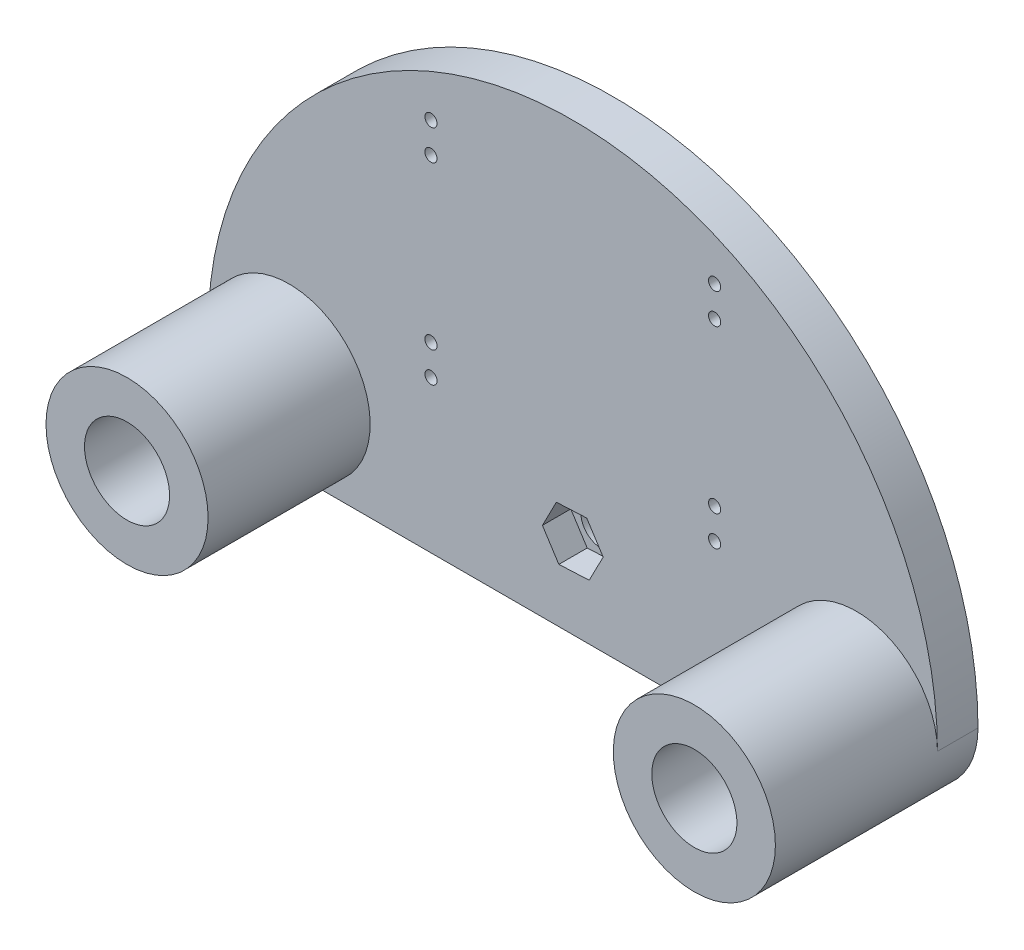
from build123d import *

# Parameters (mm, degrees)
BOSS_EXTRUDE8_OUTLINE_R   = 10.5
BOSS_EXTRUDE8_OUTLINE_R_2 = 1.5
BOSS_EXTRUDE8_DEPTH       = 10
SKETCH5_R                 = 10
SKETCH5_R_2               = 5
BOSS_EXTRUDE10_DEPTH      = 3
SKETCH7_R                 = 20
SKETCH7_R_2               = 10.5
BOSS_EXTRUDE11_DEPTH      = 50
SKETCH8_R                 = 20
SKETCH8_R_2               = 7
BOSS_EXTRUDE13_DEPTH      = 3


with BuildPart() as part:
    # Boss-Extrude8: read off the stored shape, not the designer's step
    # Boss-Extrude8 outline → Boss-Extrude8 (new body)
    with BuildSketch(Plane.XY):
        with BuildLine():
            ThreePointArc((176.037015378, 1.723482717), (86.037015378, 91.723482717), (-3.962984622, 1.723482717))
            ThreePointArc((-3.962984622, 1.723482717), (1.894879754, -12.418652907), (16.037015378, -18.276517283))
            Line((16.037015378, -18.276517283), (156.037046796, -18.241067052))
            ThreePointArc((156.037046796, -18.241067052), (170.166643311, -12.395730676), (176.037015378, 1.723482717))
        make_face()
        with Locations((16.037015378, 1.723482717)):
            Circle(BOSS_EXTRUDE8_OUTLINE_R, mode=Mode.SUBTRACT)
        Polygon((81.979520172, 8.037757496), (89.47659014, 8.394514031), (93.534085346, 2.080239251), (90.094510583, -4.590792062), (82.597440615, -4.947548597), (78.539945409, 1.366726183), align=None, mode=Mode.SUBTRACT)
        with Locations((51.037015378, 19.223482717)):
            Circle(BOSS_EXTRUDE8_OUTLINE_R_2, mode=Mode.SUBTRACT)
        with Locations((51.037015378, 26.723482717)):
            Circle(BOSS_EXTRUDE8_OUTLINE_R_2, mode=Mode.SUBTRACT)
        with Locations((156.037046796, 1.758932948)):
            Circle(BOSS_EXTRUDE8_OUTLINE_R, mode=Mode.SUBTRACT)
        with Locations((121.037015378, 19.223482717)):
            Circle(BOSS_EXTRUDE8_OUTLINE_R_2, mode=Mode.SUBTRACT)
        with Locations((121.037015378, 26.723482717)):
            Circle(BOSS_EXTRUDE8_OUTLINE_R_2, mode=Mode.SUBTRACT)
        with Locations((51.037015378, 66.723482717)):
            Circle(BOSS_EXTRUDE8_OUTLINE_R_2, mode=Mode.SUBTRACT)
        with Locations((51.037015378, 74.223482717)):
            Circle(BOSS_EXTRUDE8_OUTLINE_R_2, mode=Mode.SUBTRACT)
        with Locations((121.037015378, 66.723482717)):
            Circle(BOSS_EXTRUDE8_OUTLINE_R_2, mode=Mode.SUBTRACT)
        with Locations((121.037015378, 74.223482717)):
            Circle(BOSS_EXTRUDE8_OUTLINE_R_2, mode=Mode.SUBTRACT)
    extrude(amount=BOSS_EXTRUDE8_DEPTH)

    # Sketch5 → Boss-Extrude10 (add)
    with BuildSketch(Plane.XY):
        with Locations((86.037015378, 1.723482717)):
            Circle(SKETCH5_R)
        with Locations((86.037015378, 1.723482717)):
            Circle(SKETCH5_R_2, mode=Mode.SUBTRACT)
    extrude(amount=BOSS_EXTRUDE10_DEPTH)


with BuildPart() as boss_extrude11_tool:
    # Sketch7 → Boss-Extrude11 (new body)
    # profile 1 of 2: a face of its own
    with BuildSketch(Plane.XY):
        with Locations(Location((156.037046796, 1.758932948, 0), (0, 0, 270))):
            Circle(SKETCH7_R)
        with Locations(Location((156.037046796, 1.758932948, 0), (0, 0, 180))):
            Circle(SKETCH7_R_2, mode=Mode.SUBTRACT)
    # profile 2 of 2: a face of its own
    with BuildSketch(Plane.XY):
        with Locations(Location((16.037015378, 1.723482717, 0), (0, 0, 180))):
            Circle(SKETCH7_R)
        with Locations(Location((16.037015378, 1.723482717, 0), (0, 0, 180))):
            Circle(SKETCH7_R_2, mode=Mode.SUBTRACT)
    extrude(amount=BOSS_EXTRUDE11_DEPTH)


with BuildPart() as part_1:
    add(part.part)


with BuildPart() as part_2:
    # Boss-Extrude11: joined with boss_extrude11_tool
    add(part_1.part.fuse(boss_extrude11_tool.part, tol=0.00001))

    # Sketch8 → Boss-Extrude13 (add)
    # profile 1 of 2: a face of its own
    with BuildSketch(Plane.XY):
        with Locations(Location((16.037015378, 1.723482717, 0), (0, 0, 180))):
            Circle(SKETCH8_R)
        with Locations((16.037015378, 1.723482717)):
            Circle(SKETCH8_R_2, mode=Mode.SUBTRACT)
    # profile 2 of 2: a face of its own
    with BuildSketch(Plane.XY):
        with Locations(Location((156.037046796, 1.758932948, 0), (0, 0, 270))):
            Circle(SKETCH8_R)
        with Locations((156.037046796, 1.758932948)):
            Circle(SKETCH8_R_2, mode=Mode.SUBTRACT)
    extrude(amount=BOSS_EXTRUDE13_DEPTH)


solid = part_2.part
